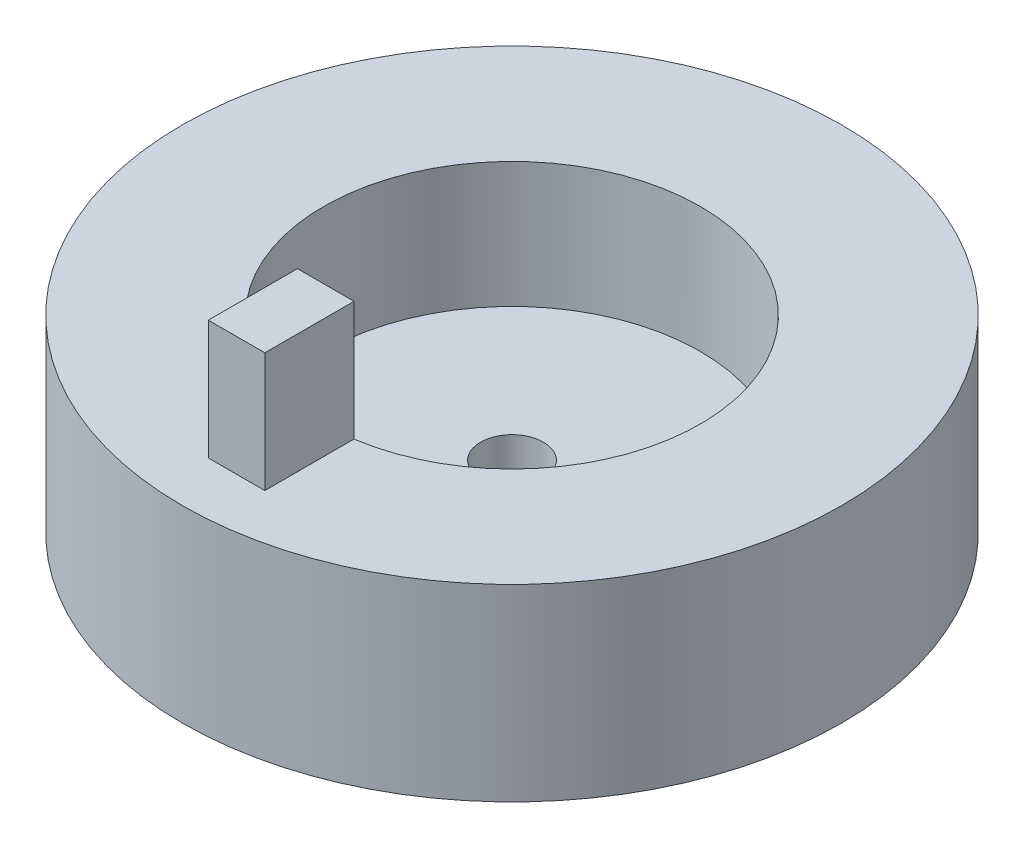
from build123d import *

# Parameters (mm, degrees)
SKIZZE1_R                       = 52.5
SKIZZE1_R_2                     = 30
AUFSATZ_LINEAR_AUSTRAGEN1_DEPTH = 20
AUFSATZ_LINEAR_START            = 10
SKIZZE2_R                       = 52.5
SKIZZE2_R_2                     = 5
AUFSATZ_LINEAR_AUSTRAGEN2_DEPTH = 10
SKIZZE3_W                       = 9
SKIZZE3_H                       = 14.2
AUFSATZ_LINEAR_AUSTRAGEN3_DEPTH = 19


with BuildPart() as part:
    # Skizze1 → Aufsatz-Linear austragen1 (new body)
    with BuildSketch(Plane(origin=(0, 0, 0), x_dir=(1, 0, 0), z_dir=(0, 1, 0))):
        Circle(SKIZZE1_R)
        Circle(SKIZZE1_R_2, mode=Mode.SUBTRACT)
    extrude(amount=AUFSATZ_LINEAR_AUSTRAGEN1_DEPTH)

    # Skizze2 → Aufsatz-Linear austragen2 (add)
    with BuildSketch(Plane.XZ.offset(AUFSATZ_LINEAR_START)):
        Circle(SKIZZE2_R)
        Circle(SKIZZE2_R_2, mode=Mode.SUBTRACT)
    extrude(amount=-AUFSATZ_LINEAR_AUSTRAGEN2_DEPTH)

    # Skizze3 → Aufsatz-Linear austragen3 (add)
    with BuildSketch(Plane(origin=(0, 20, 0), x_dir=(1, 0, 0), z_dir=(0, 1, 0))):
        with Locations((0, -36.7605799)):
            Rectangle(SKIZZE3_W, SKIZZE3_H)
    extrude(amount=AUFSATZ_LINEAR_AUSTRAGEN3_DEPTH)


solid = part.part
